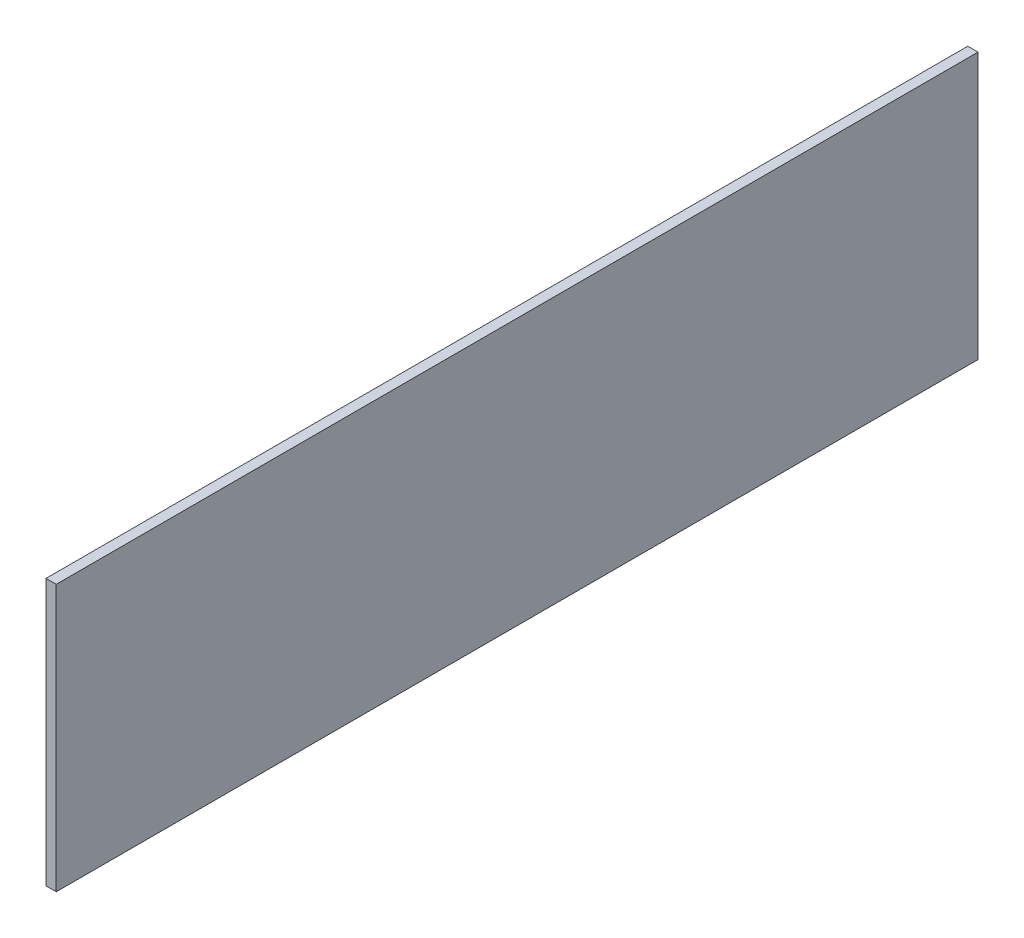
from build123d import *

# Parameters (mm, degrees)
BOSS_EXTRUDE1_DEPTH      = 10
BOSS_EXTRUDE1_DEPTH_BACK = 10
SKETCH1_W                = 520
SKETCH1_H                = 1800


with BuildPart() as part:
    # Sketch1 → Boss-Extrude1 (new, two sides: drawn at the far end of the back side and taken through both)
    with BuildSketch(Plane.YZ.offset(-BOSS_EXTRUDE1_DEPTH_BACK)):
        with Locations((260, 0)):
            Rectangle(SKETCH1_W, SKETCH1_H)
    extrude(amount=BOSS_EXTRUDE1_DEPTH + BOSS_EXTRUDE1_DEPTH_BACK)


solid = part.part
